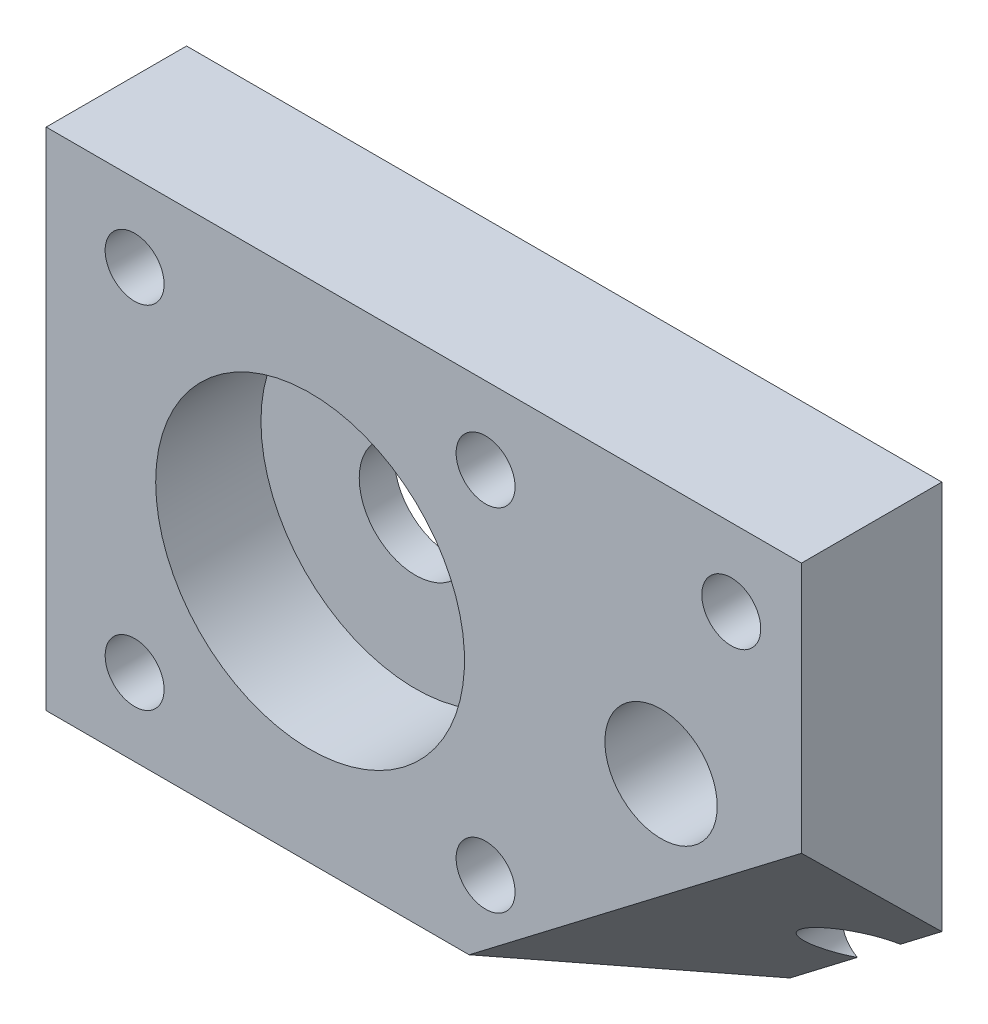
from build123d import *

# Parameters (mm, degrees)
JOTYY_MIRRORED_START         = -10
JOTYY_MIRRORED_OUTLINE_W     = 53.8
JOTYY_MIRRORED_OUTLINE_H     = 36
JOTYY_MIRRORED_OUTLINE_R     = 2.1
JOTYY_MIRRORED_OUTLINE_R_2   = 11
JOTYY_MIRRORED_DEPTH         = 10
JOTYY_MIRRORED_2_OUTLINE_R   = 11
JOTYY_MIRRORED_2_OUTLINE_R_2 = 4
JOTYY_MIRRORED_2_DEPTH       = 2.5
SKETCH1_R                    = 4
CUT_EXTRUDE1_DEPTH           = 10
CUT_EXTRUDE2_DEPTH           = 58.009529002


# Read off the part's stored shape, not the designer's step: jotyy_Mirrored
with BuildPart() as part:
    # jotyy_Mirrored outline → jotyy_Mirrored (new body)
    with BuildSketch(Plane.XY.offset(JOTYY_MIRRORED_START)):
        with Locations((-26.9, 20)):
            Rectangle(JOTYY_MIRRORED_OUTLINE_W, JOTYY_MIRRORED_OUTLINE_H)
        with Locations((-47.5, 7.5)):
            Circle(JOTYY_MIRRORED_OUTLINE_R, mode=Mode.SUBTRACT)
        with Locations((-22.5, 7.5)):
            Circle(JOTYY_MIRRORED_OUTLINE_R, mode=Mode.SUBTRACT)
        with Locations((-5, 7.5)):
            Circle(JOTYY_MIRRORED_OUTLINE_R, mode=Mode.SUBTRACT)
        with Locations((-35, 20)):
            Circle(JOTYY_MIRRORED_OUTLINE_R_2, mode=Mode.SUBTRACT)
        with Locations((-47.5, 32.5)):
            Circle(JOTYY_MIRRORED_OUTLINE_R, mode=Mode.SUBTRACT)
        with Locations((-22.5, 32.5)):
            Circle(JOTYY_MIRRORED_OUTLINE_R, mode=Mode.SUBTRACT)
        with Locations((-5, 32.5)):
            Circle(JOTYY_MIRRORED_OUTLINE_R, mode=Mode.SUBTRACT)
    extrude(amount=JOTYY_MIRRORED_DEPTH)

    # jotyy_Mirrored 2 outline → jotyy_Mirrored 2 (add)
    with BuildSketch(Plane.XY.offset(JOTYY_MIRRORED_START)):
        with Locations((-35, 20)):
            Circle(JOTYY_MIRRORED_2_OUTLINE_R)
        with Locations((-35, 20)):
            Circle(JOTYY_MIRRORED_2_OUTLINE_R_2, mode=Mode.SUBTRACT)
    extrude(amount=JOTYY_MIRRORED_2_DEPTH)

    # Sketch1 → Cut-Extrude1 (cut)
    with BuildSketch(Plane.XY):
        with Locations((-10, 20)):
            Circle(SKETCH1_R)
    extrude(amount=-CUT_EXTRUDE1_DEPTH, mode=Mode.SUBTRACT)

    # Sketch4 → Cut-Extrude2 (cut, through all)
    with BuildSketch(Plane(origin=(-6.022770261, 7.876766856, -7.746840682), x_dir=(-0.8770067574433524, -0.3073815854436153, 0.36929081809444725), z_dir=(-0.4786451376421942, 0.6259870446034146, -0.6156614753256595))):
        Polygon((61.660399682, 43.281573414), (-67.322963421, -199.854992021), (-184.813959978, -137.526300969), (-55.830596875, 105.610264465), align=None)
    extrude(amount=-CUT_EXTRUDE2_DEPTH, mode=Mode.SUBTRACT)


solid = part.part
